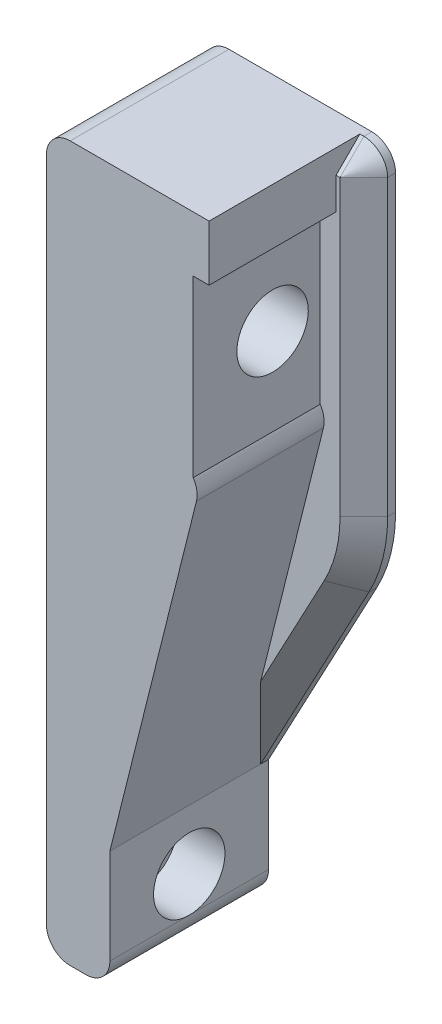
from build123d import *

# Parameters (mm, degrees)
SKETCH1_W           = 24
SKETCH1_H           = 90
BOSS_EXTRUDE1_DEPTH = 20
CUT_EXTRUDE1_DEPTH  = 16
CUT_EXTRUDE8_DEPTH  = 10
FILLET1_R           = 20
SKETCH12_R          = 2.5
CUT_EXTRUDE9_DEPTH  = 18.5
SKETCH13_R          = 4.5
CUT_EXTRUDE10_DEPTH = 16.5
FILLET2_R           = 3
CHAMFER1_SIZE       = 3


with BuildPart() as part:
    # Sketch1 → Boss-Extrude1 (new body)
    with BuildSketch(Plane.XY):
        with Locations((12, 45)):
            Rectangle(SKETCH1_W, SKETCH1_H)
    extrude(amount=-BOSS_EXTRUDE1_DEPTH)

    # Sketch4 → Cut-Extrude1 (cut)
    with BuildSketch(Plane.XY):
        Polygon((20.5, 83), (18.5, 83), (18.5, 61), (19.5, 61), (8, 15), (8, 0), (24, 0), (24, 90), (20.5, 90), align=None)
    extrude(amount=-CUT_EXTRUDE1_DEPTH, mode=Mode.SUBTRACT)

    # Sketch9 → Cut-Extrude8 (cut)
    with BuildSketch(Plane(origin=(0, 0, -20), x_dir=(-1, 0, 0), z_dir=(0, 0, -1))):
        Polygon((-24, 0), (-24, 45), (-8, 15), (-8, 0), align=None)
    extrude(amount=-CUT_EXTRUDE8_DEPTH, mode=Mode.SUBTRACT)

    # Fillet1
    fillet1_edges = [part.edges().sort_by_distance(p)[0] for p in [
        (24, 45, -18),
    ]]
    fillet(fillet1_edges, radius=FILLET1_R)

    # Sketch12 → Cut-Extrude9 (cut)
    with BuildSketch(Plane(origin=(18.5, 0, 0), x_dir=(0, 0, -1), z_dir=(1, 0, 0))):
        with Locations(Location((10, 72, 0), (0, 0, 90))):
            Circle(SKETCH12_R)
        with Locations(Location((10, 7.5, 0), (0, 0, 90))):
            Circle(SKETCH12_R)
    extrude(amount=-CUT_EXTRUDE9_DEPTH, mode=Mode.SUBTRACT)

    # Sketch13 → Cut-Extrude10 (cut)
    with BuildSketch(Plane(origin=(18.5, 0, 0), x_dir=(0, 0, -1), z_dir=(1, 0, 0))):
        with Locations(Location((10, 72, 0), (0, 0, 90))):
            Circle(SKETCH13_R)
        with Locations(Location((10, 7.5, 0), (0, 0, 90))):
            Circle(SKETCH13_R)
    extrude(amount=-CUT_EXTRUDE10_DEPTH, mode=Mode.SUBTRACT)

    # Fillet2
    # the kernel refuses this fillet: 3 mm, written as the material it takes off along each edge
    with BuildSketch(Plane(origin=(0, 90, 7.5), x_dir=(1, 0, 0), z_dir=(0, 0, -1)), Plane(origin=(8, 0, -27.5), x_dir=(0, 1, 0), z_dir=(0, 0, 1)), Plane(origin=(0, 0, 7.5), x_dir=(0, 1, 0), z_dir=(0, 0, -1))) as fillet2_piece_1:
        with BuildLine():
            CenterArc((FILLET2_R, FILLET2_R), FILLET2_R, 180, 90)
            Line((0, FILLET2_R), (-FILLET2_R * 0.02, FILLET2_R))
            Line((-FILLET2_R * 0.02, FILLET2_R), (-FILLET2_R * 0.02, -FILLET2_R * 0.02))
            Line((-FILLET2_R * 0.02, -FILLET2_R * 0.02), (FILLET2_R, -FILLET2_R * 0.02))
            Line((FILLET2_R, -FILLET2_R * 0.02), (FILLET2_R, 0))
        make_face()
    extrude(amount=35, mode=Mode.SUBTRACT)
    with BuildSketch(Plane(origin=(24, 90, -8.5), x_dir=(0, -1, 0), z_dir=(0, 0, -1))) as fillet2_piece_2:
        with BuildLine():
            CenterArc((FILLET2_R, FILLET2_R), FILLET2_R, 180, 90)
            Line((0, FILLET2_R), (-FILLET2_R * 0.02, FILLET2_R))
            Line((-FILLET2_R * 0.02, FILLET2_R), (-FILLET2_R * 0.02, -FILLET2_R * 0.02))
            Line((-FILLET2_R * 0.02, -FILLET2_R * 0.02), (FILLET2_R, -FILLET2_R * 0.02))
            Line((FILLET2_R, -FILLET2_R * 0.02), (FILLET2_R, 0))
        make_face()
    extrude(amount=19, mode=Mode.SUBTRACT)
    with BuildSketch(Plane(origin=(19.5, 61, 6.128837665), x_dir=(-0.24253562503633366, -0.9701425001453317, 0), z_dir=(0, 0, -1))) as fillet2_piece_3:
        with BuildLine():
            CenterArc((2.451535066, 3), FILLET2_R, 222.580014358, 47.419985642)
            Line((0.242535625, 0.9701425), (0.198355636, 0.92954535))
            ThreePointArc((0.198355636, 0.92954535), (0.063059263, 0.499623388), (-0.05820855, 0.014552138))
            Line((-0.05820855, 0.014552138), (0, -0.06))
            Line((0, -0.06), (2.451535066, -0.06))
            Line((2.451535066, -0.06), (2.451535066, 0))
        make_face()
    extrude(amount=22.128837665, mode=Mode.SUBTRACT)

    # Chamfer1
    # the kernel refuses this chamfer: 3 mm, written as the material it takes off along each edge
    with BuildSketch(Plane(origin=(21, 87, -16), x_dir=(1, 0, 0), z_dir=(0, -1, 0))) as chamfer1_piece_1:
        Polygon((3 - CHAMFER1_SIZE, 0), (3, -CHAMFER1_SIZE), (3, 0), align=None)
    revolve(axis=Axis((21, 87, -16), (0, 0, 1)), revolution_arc=90, mode=Mode.SUBTRACT)
    with BuildSketch(Plane(origin=(24, 50, -16), x_dir=(-1, 0, 0), z_dir=(0, 1, 0))) as chamfer1_piece_2:
        Polygon((CHAMFER1_SIZE, 0), (0, -CHAMFER1_SIZE), (0, 0), align=None)
    extrude(amount=37, mode=Mode.SUBTRACT)
    with BuildSketch(Plane(origin=(4.369388723, 8.192603855, -16), x_dir=(0, 0, -1), z_dir=(0.47058823529411764, 0.8823529411764706, 0))) as chamfer1_piece_3_section:
        Polygon((CHAMFER1_SIZE, 0), (0, CHAMFER1_SIZE), (0, 0), align=None)
    chamfer1_piece_3 = extrude(amount=36.715048964, mode=Mode.PRIVATE)
    chamfer1_piece_3 = split(chamfer1_piece_3, bisect_by=Plane(origin=(8, 8.192603855, -16), z_dir=(1, 0, 0)), keep=Keep.TOP, mode=Mode.PRIVATE)
    chamfer1_piece_3 = split(chamfer1_piece_3, bisect_by=Plane(origin=(6.184694361, 7.738777446, -16), z_dir=(0.9701425001453319, -0.24253562503633322, 0)), keep=Keep.TOP, mode=Mode.PRIVATE)
    add(chamfer1_piece_3, mode=Mode.SUBTRACT)
    with BuildSketch(Plane(origin=(4, 50, -16), x_dir=(0.8823529411764705, -0.47058823529411764, 0), z_dir=(-0.47058823529411764, -0.8823529411764705, 0))) as chamfer1_piece_4:
        Polygon((20, -CHAMFER1_SIZE), (20 - CHAMFER1_SIZE, 0), (20, 0), align=None)
    revolve(axis=Axis((4, 50, -16), (0, 0, 1)), revolution_arc=28.072486936, mode=Mode.SUBTRACT)
    with BuildSketch(Plane(origin=(21, 90, -16), x_dir=(0, -1, 0), z_dir=(-1, 0, 0))) as chamfer1_piece_5:
        Polygon((CHAMFER1_SIZE, 0), (0, -CHAMFER1_SIZE), (0, 0), align=None)
    extrude(amount=0.5, mode=Mode.SUBTRACT)


solid = part.part
